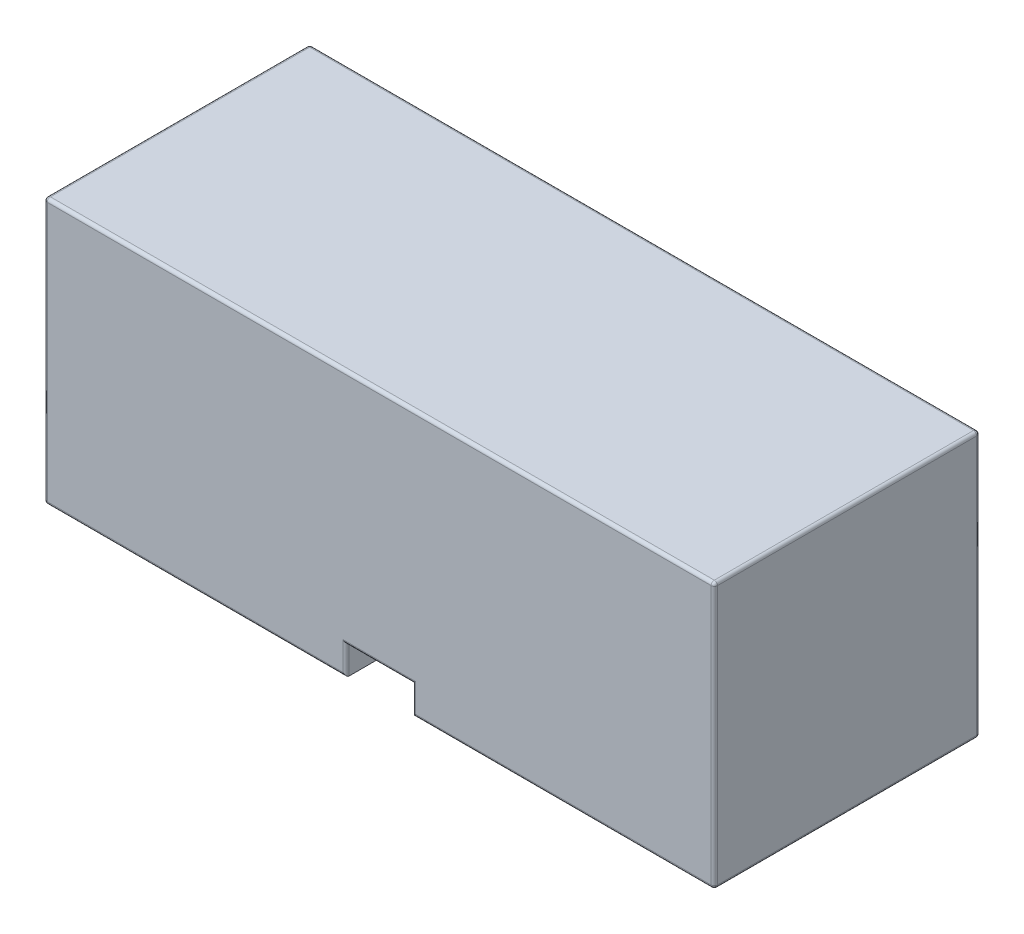
from build123d import *

# Parameters (mm, degrees)
ESQUISSE1_W               = 106
ESQUISSE1_H               = 42
BOSS_EXTRU_1_DEPTH        = 42
ESQUISSE2_W               = 10.5
ESQUISSE2_H               = 10.5
ENL_V_MAT_EXTRU_1_DEPTH   = 4.5
CONG_1_R                  = 0.5
SYM_TRIE2_COPY_1_SKETCH_W = 10.5
SYM_TRIE2_COPY_1_SKETCH_H = 10.5
SYM_TRIE2_COPY_1_DEPTH    = 4.5
SYM_TRIE2_COPY_2_SKETCH_W = 10.5
SYM_TRIE2_COPY_2_SKETCH_H = 10.5
SYM_TRIE2_COPY_2_DEPTH    = 4.5


with BuildPart() as part:
    # Esquisse1 → Boss.-Extru.1 (new body)
    with BuildSketch(Plane.XY):
        with Locations((53, -21)):
            Rectangle(ESQUISSE1_W, ESQUISSE1_H)
    extrude(amount=BOSS_EXTRU_1_DEPTH)

    # Esquisse2 → Enlèv. mat.-Extru.1 (cut)
    with BuildSketch(Plane.XZ.offset(42)):
        with Locations((53, 39.75)):
            Rectangle(ESQUISSE2_W, ESQUISSE2_H)
        with Locations((68.75, 21)):
            Rectangle(ESQUISSE2_W, ESQUISSE2_H)
    enl_v_mat_extru_1 = extrude(amount=-ENL_V_MAT_EXTRU_1_DEPTH, mode=Mode.SUBTRACT)

    # Congé1
    cong_1_edges = [part.edges().sort_by_distance(p)[0] for p in [
        (0, -42, 21),
        (82.125, -42, 42),
        (23.875, -42, 42),
        (0, -21, 42),
        (106, -42, 21),
        (106, -21, 42),
        (53, -42, 0),
        (106, -21, 0),
        (0, -21, 0),
        (106, 0, 21),
        (53, 0, 42),
        (0, 0, 21),
        (53, 0, 0),
        (58.25, -39.75, 42),
        (53, -37.5, 42),
        (47.75, -39.75, 42),
    ]]
    fillet(cong_1_edges, radius=CONG_1_R)

    # Symétrie1: Enlèv. mat.-Extru.1 across plane
    add(enl_v_mat_extru_1.mirror(Plane(origin=(53, 0, 0), x_dir=(0, 0, 1), z_dir=(1, 0, 0))), mode=Mode.SUBTRACT)

    # Symétrie2 copy 1 sketch → Symétrie2 copy 1 (cut)
    with BuildSketch(Plane(origin=(106, -42, 42), x_dir=(-1, 0, 0), z_dir=(0, -1, 0))):
        with Locations((53, 39.75)):
            Rectangle(SYM_TRIE2_COPY_1_SKETCH_W, SYM_TRIE2_COPY_1_SKETCH_H)
        with Locations((68.75, 21)):
            Rectangle(SYM_TRIE2_COPY_1_SKETCH_W, SYM_TRIE2_COPY_1_SKETCH_H)
    extrude(amount=-SYM_TRIE2_COPY_1_DEPTH, mode=Mode.SUBTRACT)

    # Symétrie2 copy 2 sketch → Symétrie2 copy 2 (cut)
    with BuildSketch(Plane(origin=(0, -42, 42), x_dir=(1, 0, 0), z_dir=(0, -1, 0))):
        with Locations((53, -39.75)):
            Rectangle(SYM_TRIE2_COPY_2_SKETCH_W, SYM_TRIE2_COPY_2_SKETCH_H)
        with Locations((68.75, -21)):
            Rectangle(SYM_TRIE2_COPY_2_SKETCH_W, SYM_TRIE2_COPY_2_SKETCH_H)
    extrude(amount=-SYM_TRIE2_COPY_2_DEPTH, mode=Mode.SUBTRACT)


solid = part.part
